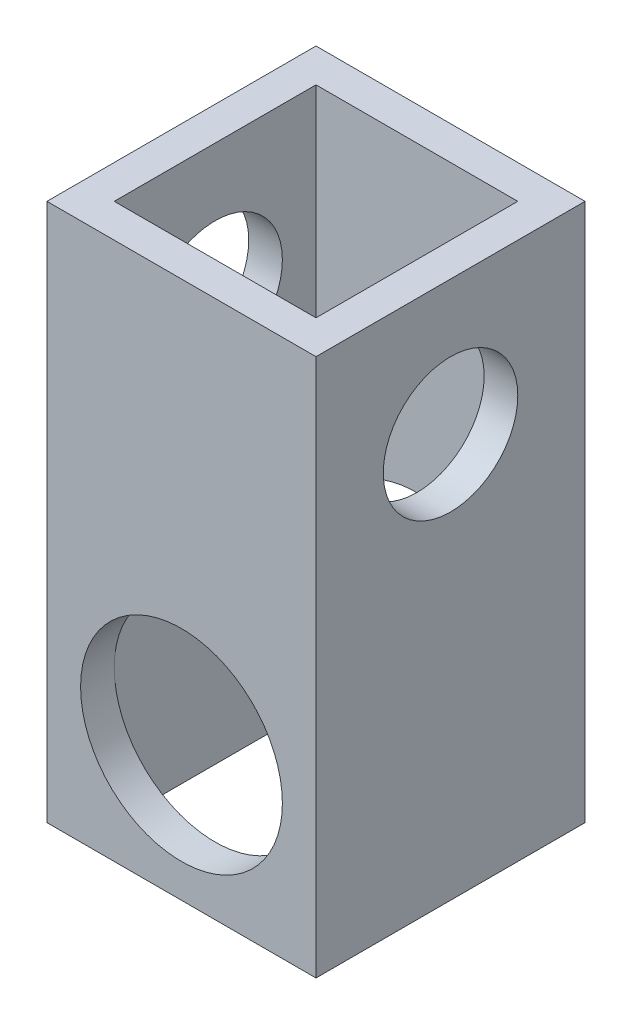
from build123d import *

# Parameters (mm, degrees)
SKETCH1_W           = 25.4
SKETCH1_H           = 25.4
SKETCH1_W_2         = 19.05
SKETCH1_H_2         = 19.05
EXTRUDE_THIN1_DEPTH = 50.8
SKETCH2_R           = 6.35
CUT_EXTRUDE1_DEPTH  = 59.198711326
SKETCH3_R           = 9.525
CUT_EXTRUDE2_DEPTH  = 59.198711326


with BuildPart() as part:
    # Sketch1 → Extrude-Thin1 (new body)
    with BuildSketch(Plane(origin=(0, 0, 0), x_dir=(1, 0, 0), z_dir=(0, 1, 0))):
        Rectangle(SKETCH1_W, SKETCH1_H)
        Rectangle(SKETCH1_W_2, SKETCH1_H_2, mode=Mode.SUBTRACT)
    extrude(amount=EXTRUDE_THIN1_DEPTH)

    # Sketch2 → Cut-Extrude1 (cut, through all)
    with BuildSketch(Plane(origin=(12.7, 0, 0), x_dir=(0, 0, -1), z_dir=(1, 0, 0))):
        with Locations((0, 38.1)):
            Circle(SKETCH2_R)
    extrude(amount=-CUT_EXTRUDE1_DEPTH, mode=Mode.SUBTRACT)

    # Sketch3 → Cut-Extrude2 (cut, through all)
    with BuildSketch(Plane(origin=(0, 0, -12.7), x_dir=(-1, 0, 0), z_dir=(0, 0, -1))):
        with Locations((0, 12.7)):
            Circle(SKETCH3_R)
    extrude(amount=-CUT_EXTRUDE2_DEPTH, mode=Mode.SUBTRACT)


solid = part.part
